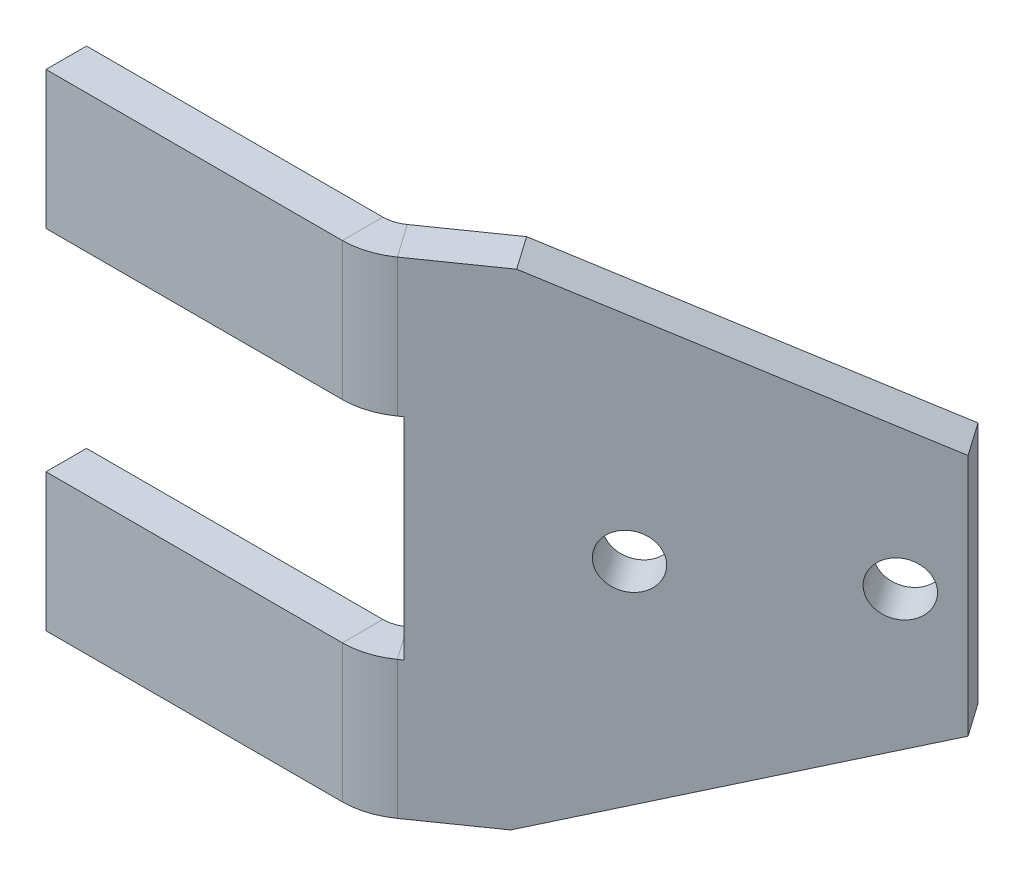
from build123d import *

# Parameters (mm, degrees)
SM_BASE_FLANGE_1_DEPTH = 2.5
HOLE_WIZARD_M41_D      = 3.3
OTHER_START            = 45.056896686
OTHER_7_OUTLINE_R      = 1.65
OTHER_7_DEPTH          = 7.095461821
OTHER_START_2          = 22.961384977
OTHER_7_2_DEPTH        = 30
OTHER_START_3          = 31.461384977
OTHER_7_3_DEPTH        = 13
OTHER_START_4          = 39.611384977
OTHER_7_4_DEPTH        = 5.85
OTHER_START_5          = 30.461384977
OTHER_7_5_DEPTH        = 5.8499999
OTHER_7_6_DEPTH        = 8.5
OTHER_START_6          = 44.461384977
OTHER_7_7_DEPTH        = 8.5
OTHER_START_7          = 40.219785041
OTHER_7_8_DEPTH        = 2.5


with BuildPart() as part:
    # Базовая кромка1: sheet metal written as solids
    # Sketch 1 → Базовая кромка1 (new body)
    with BuildSketch(Plane.XY):
        Polygon((54.77467234, 44.461384977), (73.77467234, 44.461384977), (73.77467234, 31.461384977), (54.77467234, 31.461384977), (54.77467234, 22.961384977), (78.511603406, 22.961384977), (98.77467234, 30.461384977), (98.77467234, 45.461384977), (78.77467234, 52.961384977), (54.77467234, 52.961384977), align=None)
    extrude(amount=-SM_BASE_FLANGE_1_DEPTH)

    # Отверстие обработанное метчиком M41 (through all)
    with Locations(Plane.XY):
        with Locations((83.77467234, 37.961384977), (95.77467234, 37.961384977)):
            Hole(HOLE_WIZARD_M41_D / 2)

    # Other 7: read off the stored shape, not the designer's step
    # Other 7 outline → Other 7 (cut)
    with BuildSketch(Plane(origin=(0, 0, 0), x_dir=(0.819152044288991, 0, -0.5735764363510472), z_dir=(0.5735764363510472, 0, 0.8191520442889911)).offset(OTHER_START)):
        with Locations((72.715175855, 37.961384977)):
            Circle(OTHER_7_OUTLINE_R)
    extrude(amount=OTHER_7_DEPTH, mode=Mode.SUBTRACT)

    # Other 7 2 outline → Other 7 2 (cut)
    with BuildSketch(Plane(origin=(0, 0, 0), x_dir=(1, 0, 0), z_dir=(0, 1, 0)).offset(OTHER_START_2)):
        with BuildLine():
            Line((98.77467234, 2.5), (78.050042356, 2.5))
            Line((78.050042356, 2.5), (75.641921753, 0.813815801))
            ThreePointArc((75.641921753, 0.813815801), (74.414003887, 0.208273722), (73.06082779, 0))
            Line((73.06082779, 0), (98.77467234, 0))
            Line((98.77467234, 0), (98.77467234, 2.5))
        make_face()
    extrude(amount=OTHER_7_2_DEPTH, mode=Mode.SUBTRACT)

    # Other 7 3 outline → Other 7 3 (cut)
    with BuildSketch(Plane(origin=(0, 0, 0), x_dir=(1, 0, 0), z_dir=(0, 1, 0)).offset(OTHER_START_3)):
        with BuildLine():
            Line((75.641921753, 0.813815801), (75.876326575, 0.977947824))
            Line((75.876326575, 0.977947824), (74.810574168, 2.5))
            Line((74.810574168, 2.5), (73.77467234, 2.5))
            Line((73.77467234, 2.5), (73.77467234, 0.056980086))
            ThreePointArc((73.77467234, 0.056980086), (74.751199059, 0.329550987), (75.641921753, 0.813815801))
        make_face()
    extrude(amount=OTHER_7_3_DEPTH, mode=Mode.SUBTRACT)

    # Other 7 4 outline → Other 7 4 (add)
    with BuildSketch(Plane(origin=(0, 0, 0), x_dir=(1, 0, 0), z_dir=(0, 1, 0)).offset(OTHER_START_4)):
        Polygon((78.050042356, 2.5), (96.355127682, 15.317358733), (94.921186591, 17.365238843), (74.442385484, 3.025827935), (74.810574168, 2.5), align=None)
    extrude(amount=OTHER_7_4_DEPTH)

    # Other 7 5 outline → Other 7 5 (add)
    with BuildSketch(Plane(origin=(0, 0, 0), x_dir=(1, 0, 0), z_dir=(0, 1, 0)).offset(OTHER_START_5)):
        Polygon((78.050042356, 2.5), (96.355127682, 15.317358733), (94.921186591, 17.365238843), (74.442385484, 3.025827935), (74.810574168, 2.5), align=None)
    extrude(amount=OTHER_7_5_DEPTH)

    # Other 7 6 outline → Other 7 6 (add)
    with BuildSketch(Plane(origin=(0, 0, 0), x_dir=(1, 0, 0), z_dir=(0, 1, 0)).offset(OTHER_START_2)):
        with BuildLine():
            Line((74.810574168, 2.5), (74.442385484, 3.025827935))
            Line((74.442385484, 3.025827935), (74.207980662, 2.861695911))
            ThreePointArc((74.207980662, 2.861695911), (73.662239388, 2.592566099), (73.06082779, 2.5))
            Line((73.06082779, 2.5), (74.810574168, 2.5))
        make_face()
    extrude(amount=OTHER_7_6_DEPTH)

    # Other 7 7 outline → Other 7 7 (add)
    with BuildSketch(Plane(origin=(0, 0, 0), x_dir=(1, 0, 0), z_dir=(0, 1, 0)).offset(OTHER_START_6)):
        with BuildLine():
            Line((74.810574168, 2.5), (74.442385484, 3.025827935))
            Line((74.442385484, 3.025827935), (74.207980662, 2.861695911))
            ThreePointArc((74.207980662, 2.861695911), (73.662239388, 2.592566099), (73.06082779, 2.5))
            Line((73.06082779, 2.5), (74.810574168, 2.5))
        make_face()
    extrude(amount=OTHER_7_7_DEPTH)

    # Other 7 8 outline → Other 7 8 (add)
    with BuildSketch(Plane(origin=(0, 0, 0), x_dir=(0.819152044288991, 0, -0.5735764363510472), z_dir=(0.5735764363510472, 0, 0.8191520442889911)).offset(OTHER_START_7)):
        Polygon((87.715175855, 45.461384977), (67.715175855, 52.961384977), (62.715175855, 52.961384977), (62.715175855, 45.461384977), align=None)
        Polygon((67.452106922, 22.961384977), (87.715175855, 30.461384977), (62.715175855, 30.461384977), (62.715175855, 22.961384977), align=None)
        with BuildLine():
            Line((87.715175855, 36.311384877), (87.715175855, 39.611384977))
            Line((87.715175855, 39.611384977), (84.715175855, 39.611384977))
            ThreePointArc((84.715175855, 39.611384977), (86.365175855, 37.961384977), (84.715175855, 36.311384977))
            Line((84.715175855, 36.311384977), (87.715175855, 36.311384877))
        make_face()
        with BuildLine():
            ThreePointArc((84.715175855, 36.311384977), (83.065175855, 37.961384977), (84.715175855, 39.611384977))
            Line((84.715175855, 39.611384977), (72.715175855, 39.611384977))
            ThreePointArc((72.715175855, 39.611384977), (74.365175855, 37.961384977), (72.715175855, 36.311384977))
            Line((72.715175855, 36.311384977), (84.715175855, 36.311384977))
        make_face()
        with BuildLine():
            ThreePointArc((72.715175855, 36.311384977), (71.065175855, 37.961384977), (72.715175855, 39.611384977))
            Line((72.715175855, 39.611384977), (62.715175855, 39.611384977))
            Line((62.715175855, 39.611384977), (62.715175855, 36.311384877))
            Line((62.715175855, 36.311384877), (72.715175855, 36.311384977))
        make_face()
    extrude(amount=OTHER_7_8_DEPTH)


solid = part.part
